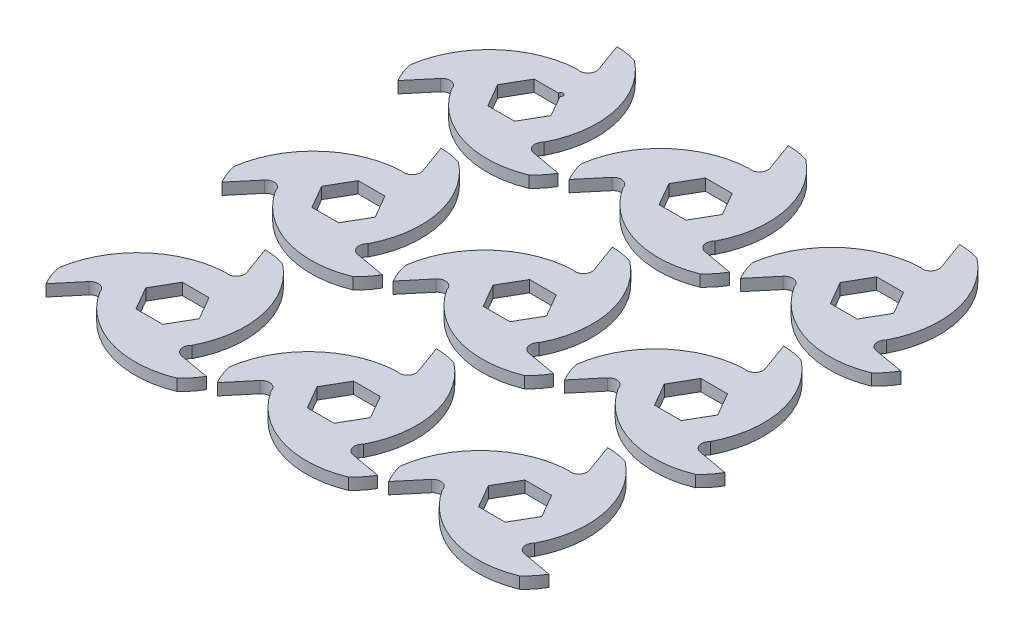
from build123d import *

# Parameters (mm, degrees)
BOSS_EXTRUDE2_DEPTH = 3.175
CUT_EXTRUDE1_DEPTH  = 71.887102156
LPATTERN1_COUNT     = 3
LPATTERN1_PITCH     = 96.52
LPATTERN1_2_COUNT   = 3
LPATTERN1_2_PITCH   = 93.98
SKETCH4_R           = 1.27
CUT_EXTRUDE2_DEPTH  = 328.532303151


with BuildPart() as part:
    # Sketch2 → Boss-Extrude2 (new, symmetric)
    with BuildSketch(Plane(origin=(0, 0, 0), x_dir=(1, 0, 0), z_dir=(0, 1, 0))):
        with BuildLine():
            Line((0, 50.8), (5.699182497, 35.141624781))
            ThreePointArc((5.699182497, 35.141624781), (4.697625818, 30.400196659), (0, 29.21))
            ThreePointArc((0, 29.21), (-40.712457699, 16.982230342), (-43.994090512, -25.4))
            Line((-43.994090512, -25.4), (-33.283131039, -12.635175567))
            ThreePointArc((-33.283131039, -12.635175567), (-28.676155496, -11.131835033), (-25.296602045, -14.605))
            ThreePointArc((-25.296602045, -14.605), (5.64918596, -43.749137789), (43.994090512, -25.4))
            Line((43.994090512, -25.4), (27.583948542, -22.506449213))
            ThreePointArc((27.583948542, -22.506449213), (23.978529677, -19.268361626), (25.296602045, -14.605))
            ThreePointArc((25.296602045, -14.605), (35.063271738, 26.766907447), (0, 50.8))
        make_face()
        Polygon((14.664696837, 0), (7.332348419, -12.7), (-7.332348419, -12.7), (-14.664696837, 0), (-7.332348419, 12.7), (7.332348419, 12.7), align=None, mode=Mode.SUBTRACT)
    extrude(amount=BOSS_EXTRUDE2_DEPTH, both=True)

    # Sketch3 → Cut-Extrude1 (cut, through all)
    with BuildSketch(Plane(origin=(0, 3.175, 0), x_dir=(1, 0, 0), z_dir=(0, 1, 0))):
        with BuildLine():
            ThreePointArc((-25.296602045, -14.605), (0.069562989, -42.437673587), (36.840744267, -34.314849269))
            ThreePointArc((36.840744267, -34.314849269), (2.193682996, -35.741164715), (-25.296602045, -14.605))
        make_face()
        with BuildLine():
            ThreePointArc((11.297159061, 49.062445064), (29.855915106, 19.77036756), (25.296602045, -14.605))
            ThreePointArc((25.296602045, -14.605), (36.717321909, 21.279080109), (11.297159061, 49.062445064))
        make_face()
        with BuildLine():
            ThreePointArc((0, 29.21), (-36.786884898, 21.158593478), (-48.137903328, -14.747595795))
            ThreePointArc((-48.137903328, -14.747595795), (-32.049598102, 15.970797155), (0, 29.21))
        make_face()
    extrude(amount=-CUT_EXTRUDE1_DEPTH, mode=Mode.SUBTRACT)


with BuildPart() as lpattern1_1:
    # LPattern1: pattern copy
    add(part.part.moved(Location(Vector(0, 0, 1) * (1 * LPATTERN1_PITCH))))


with BuildPart() as lpattern1_2:
    # LPattern1: pattern copy
    add(part.part.moved(Location(Vector(0, 0, 1) * (2 * LPATTERN1_PITCH))))


with BuildPart() as lpattern1_2_1:
    # LPattern1 2: pattern copy
    add(part.part.moved(Location(Vector(1, 0, 0) * (1 * LPATTERN1_2_PITCH))))


with BuildPart() as lpattern1_2_2:
    # LPattern1 2: pattern copy
    add(part.part.moved(Location(Vector(1, 0, 0) * (2 * LPATTERN1_2_PITCH))))


with BuildPart() as lpattern1_2_3:
    # LPattern1 2: pattern copy
    add(lpattern1_1.part.moved(Location(Vector(1, 0, 0) * (1 * LPATTERN1_2_PITCH))))


with BuildPart() as lpattern1_2_4:
    # LPattern1 2: pattern copy
    add(lpattern1_1.part.moved(Location(Vector(1, 0, 0) * (2 * LPATTERN1_2_PITCH))))


with BuildPart() as lpattern1_2_5:
    # LPattern1 2: pattern copy
    add(lpattern1_2.part.moved(Location(Vector(1, 0, 0) * (1 * LPATTERN1_2_PITCH))))


with BuildPart() as lpattern1_2_6:
    # LPattern1 2: pattern copy
    add(lpattern1_2.part.moved(Location(Vector(1, 0, 0) * (2 * LPATTERN1_2_PITCH))))


with BuildPart() as part_1:
    add(part.part)

    # Sketch4 → Cut-Extrude2 (cut, through all)
    with BuildSketch(Plane(origin=(0, 3.175, 0), x_dir=(1, 0, 0), z_dir=(0, 1, 0))):
        with Locations((7.332348419, 12.7)):
            Circle(SKETCH4_R)
    extrude(amount=-CUT_EXTRUDE2_DEPTH, mode=Mode.SUBTRACT)


solid = Compound([lpattern1_1.part, lpattern1_2.part, lpattern1_2_1.part, lpattern1_2_2.part, lpattern1_2_3.part, lpattern1_2_4.part, lpattern1_2_5.part, lpattern1_2_6.part, part_1.part])
